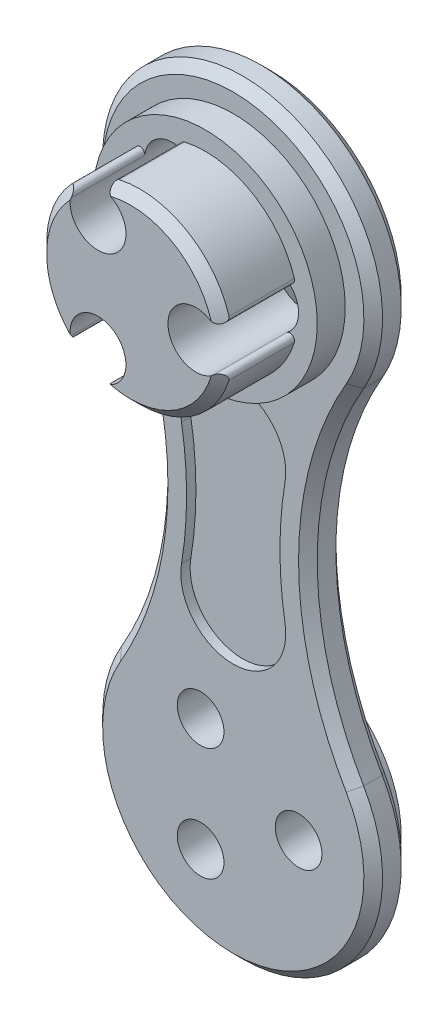
from build123d import *

# Parameters (mm, degrees)
EXTRUDE_1_DEPTH     = 1
SKETCH_2_R          = 6
EXTRUDE_2_DEPTH     = 1.5
SKETCH_3_R          = 7.5
EXTRUDE_3_DEPTH     = 1
SKETCH_4_R          = 5
EXTRUDE_4_DEPTH     = 4
CUT_EXTRUDE_2_DEPTH = 24.416996253
EXTRUDE_START       = -3.5
SKETCH_13_R         = 6
EXTRUDE_7_DEPTH     = 3.5
EXTRUDE_START_2     = -3
SKETCH_14_R         = 7.5
SKETCH_14_R_2       = 1.5
EXTRUDE_8_DEPTH     = 3
SKETCH_18_R         = 1.5
CUT_EXTRUDE_3_DEPTH = 23.279042024
SKETCH_19_R         = 1.5
SKETCH_19_R_2       = 1
EXTRUDE_9_DEPTH     = 3
M3X0_5_1_D          = 2.5
CUT_EXTRUDE_START   = -1
SKETCH_22_R         = 7.5
SKETCH_22_R_2       = 6
CUT_EXTRUDE_4_DEPTH = 1
CHAMFER_1_SIZE      = 1.7
CHAMFER_2_SIZE      = 0.5
CUT_EXTRUDE_5_DEPTH = 0.5
CUT_EXTRUDE_START_2 = -0.5
CUT_EXTRUDE_6_DEPTH = 0.5


with BuildPart() as part:
    # ｽｹｯﾁ1 → ﾎﾞｽ - 押し出し1 (new, symmetric)
    with BuildSketch(Plane.XY):
        with BuildLine():
            ThreePointArc((6.484806622, 9.222452779), (0, 20.490381), (-6.484806622, 9.222452779))
            ThreePointArc((-6.484806622, 9.222452779), (-4, 0), (-6.484806622, -9.222452779))
            ThreePointArc((-6.484806622, -9.222452779), (0, -20.490381), (6.484806622, -9.222452779))
            ThreePointArc((6.484806622, -9.222452779), (4, 0), (6.484806622, 9.222452779))
        make_face()
    extrude(amount=EXTRUDE_1_DEPTH, both=True)

    # ｽｹｯﾁ2 → ﾎﾞｽ - 押し出し2 (add)
    with BuildSketch(Plane.XY.offset(1)):
        with Locations(Location((0, 12.990381, 0), (0, 0, 180))):
            Circle(SKETCH_2_R)
    extrude(amount=EXTRUDE_2_DEPTH)

    # ｽｹｯﾁ3 → ﾎﾞｽ - 押し出し3 (add)
    with BuildSketch(Plane(origin=(0, 0, -1), x_dir=(-1, 0, 0), z_dir=(0, 0, -1))):
        with Locations((0, -12.990381)):
            Circle(SKETCH_3_R)
    extrude(amount=EXTRUDE_3_DEPTH)

    # ｽｹｯﾁ4 → ﾎﾞｽ - 押し出し4 (add)
    with BuildSketch(Plane.XY.offset(2.5)):
        with Locations((0, 12.990381)):
            Circle(SKETCH_4_R)
    extrude(amount=EXTRUDE_4_DEPTH)

    # ｽｹｯﾁ10 → ｶｯﾄ - 押し出し2 (cut, through all)
    with BuildSketch(Plane.XY.offset(6.5)):
        with BuildLine():
            ThreePointArc((-3.240977431, 16.185744986), (-1, 14.722431808), (-1.146777671, 17.394831782))
            ThreePointArc((-1.146777671, 17.394831782), (-1.295092138, 17.647661172), (-1.101305912, 17.867585659))
            ThreePointArc((-1.101305912, 17.867585659), (-2.5, 17.320508019), (-3.673130179, 16.382742226))
            ThreePointArc((-3.673130179, 16.382742226), (-3.385776872, 16.440603778), (-3.240977431, 16.185744986))
        make_face()
        with BuildLine():
            ThreePointArc((4.387755102, 14.199467795), (2, 12.990381), (4.387755102, 11.781294205))
            ThreePointArc((4.387755102, 11.781294205), (4.68086901, 11.783323606), (4.77443609, 11.505537567))
            ThreePointArc((4.77443609, 11.505537567), (5, 12.990381), (4.77443609, 14.475224433))
            ThreePointArc((4.77443609, 14.475224433), (4.68086901, 14.197438394), (4.387755102, 14.199467795))
        make_face()
        with BuildLine():
            ThreePointArc((-1.146777671, 8.585930218), (-1, 11.258330192), (-3.240977431, 9.795017014))
            ThreePointArc((-3.240977431, 9.795017014), (-3.385776872, 9.540158222), (-3.673130179, 9.598019774))
            ThreePointArc((-3.673130179, 9.598019774), (-2.5, 8.660253981), (-1.101305912, 8.113176341))
            ThreePointArc((-1.101305912, 8.113176341), (-1.295092138, 8.333100828), (-1.146777671, 8.585930218))
        make_face()
        with BuildLine():
            ThreePointArc((-3.673130179, -9.598019774), (-2.5, -8.660253981), (-1.101305912, -8.113176341))
            ThreePointArc((-1.101305912, -8.113176341), (-1.295092138, -8.333100828), (-1.146777671, -8.585930218))
            ThreePointArc((-1.146777671, -8.585930218), (-1, -11.258330192), (-3.240977431, -9.795017014))
            ThreePointArc((-3.240977431, -9.795017014), (-3.385776872, -9.540158222), (-3.673130179, -9.598019774))
        make_face()
        with BuildLine():
            ThreePointArc((4.77443609, -11.505537567), (5, -12.990381), (4.77443609, -14.475224433))
            ThreePointArc((4.77443609, -14.475224433), (4.68086901, -14.197438394), (4.387755102, -14.199467795))
            ThreePointArc((4.387755102, -14.199467795), (2, -12.990381), (4.387755102, -11.781294205))
            ThreePointArc((4.387755102, -11.781294205), (4.68086901, -11.783323606), (4.77443609, -11.505537567))
        make_face()
        with BuildLine():
            ThreePointArc((-1.101305912, -17.867585659), (-2.5, -17.320508019), (-3.673130179, -16.382742226))
            ThreePointArc((-3.673130179, -16.382742226), (-3.385776872, -16.440603778), (-3.240977431, -16.185744986))
            ThreePointArc((-3.240977431, -16.185744986), (-1, -14.722431808), (-1.146777671, -17.394831782))
            ThreePointArc((-1.146777671, -17.394831782), (-1.295092138, -17.647661172), (-1.101305912, -17.867585659))
        make_face()
    extrude(amount=-CUT_EXTRUDE_2_DEPTH, mode=Mode.SUBTRACT)

    # ｽｹｯﾁ13 → ﾎﾞｽ - 押し出し7 (add)
    with BuildSketch(Plane.XY.offset(2.5).offset(EXTRUDE_START)):
        with Locations(Location((0, 12.990381, 0), (0, 0, 180))):
            Circle(SKETCH_13_R)
    extrude(amount=EXTRUDE_7_DEPTH)

    # ｽｹｯﾁ14 → ﾎﾞｽ - 押し出し8 (add)
    with BuildSketch(Plane(origin=(0, 0, -2), x_dir=(-1, 0, 0), z_dir=(0, 0, -1)).offset(EXTRUDE_START_2)):
        with Locations((0, -12.990381)):
            Circle(SKETCH_14_R)
        with Locations((1.75, -9.959292087)):
            Circle(SKETCH_14_R_2, mode=Mode.SUBTRACT)
        with Locations((1.75, -16.021469913)):
            Circle(SKETCH_14_R_2, mode=Mode.SUBTRACT)
        with Locations((-3.5, -12.990381)):
            Circle(SKETCH_14_R_2, mode=Mode.SUBTRACT)
    extrude(amount=EXTRUDE_8_DEPTH)

    # ｽｹｯﾁ18 → ｶｯﾄ - 押し出し3 (cut, through all)
    with BuildSketch(Plane.XY.offset(2.5)):
        with Locations(Location((3.5, 12.990381, 0), (0, 0, 53.712542915))):
            Circle(SKETCH_18_R)
        with Locations(Location((-1.75, 16.021469913, 0), (0, 0, 66.287457085))):
            Circle(SKETCH_18_R)
        with Locations(Location((-1.75, 9.959292087, 0), (0, 0, 293.712542915))):
            Circle(SKETCH_18_R)
    extrude(amount=-CUT_EXTRUDE_3_DEPTH, mode=Mode.SUBTRACT)

    # ｽｹｯﾁ19 → ﾎﾞｽ - 押し出し9 (add)
    # profile 1 of 3: a face of its own
    with BuildSketch(Plane(origin=(0, 0, -2), x_dir=(-1, 0, 0), z_dir=(0, 0, -1)).offset(EXTRUDE_START_2)):
        with Locations((1.75, -9.959292087)):
            Circle(SKETCH_19_R)
        with Locations((1.75, -9.959292087)):
            Circle(SKETCH_19_R_2, mode=Mode.SUBTRACT)
    # profile 2 of 3: a face of its own
    with BuildSketch(Plane(origin=(0, 0, -2), x_dir=(-1, 0, 0), z_dir=(0, 0, -1)).offset(EXTRUDE_START_2)):
        with Locations((1.75, -16.021469913)):
            Circle(SKETCH_19_R)
        with Locations((1.75, -16.021469913)):
            Circle(SKETCH_19_R_2, mode=Mode.SUBTRACT)
    # profile 3 of 3: a face of its own
    with BuildSketch(Plane(origin=(0, 0, -2), x_dir=(-1, 0, 0), z_dir=(0, 0, -1)).offset(EXTRUDE_START_2)):
        with Locations((-3.5, -12.990381)):
            Circle(SKETCH_19_R)
        with Locations((-3.5, -12.990381)):
            Circle(SKETCH_19_R_2, mode=Mode.SUBTRACT)
    extrude(amount=EXTRUDE_9_DEPTH)

    # M3x0.5 ねじ穴1 (through all)
    with Locations(Plane.XY.offset(1)):
        with Locations((-1.75, -9.959292087), (-1.75, -16.021469913), (3.5, -12.990381)):
            Hole(M3X0_5_1_D / 2)

    # ｽｹｯﾁ22 → ｶｯﾄ - 押し出し4 (cut)
    with BuildSketch(Plane(origin=(0, 0, -2), x_dir=(-1, 0, 0), z_dir=(0, 0, -1)).offset(CUT_EXTRUDE_START)):
        with Locations((0, -12.990381)):
            Circle(SKETCH_22_R)
        with Locations((0, -12.990381)):
            Circle(SKETCH_22_R_2, mode=Mode.SUBTRACT)
    extrude(amount=CUT_EXTRUDE_4_DEPTH, mode=Mode.SUBTRACT)

    # 面取り1
    # the kernel refuses this chamfer: 1.7 mm, written as the material it takes off along each edge
    with BuildSketch(Plane(origin=(3.5, 12.990381, -1), x_dir=(0.5918367346923316, 0.8060578635983391, 0), z_dir=(0.8060578635983391, -0.5918367346923316, 0))) as chamfer_1_piece_1:
        Polygon((1.5, CHAMFER_1_SIZE), (1.5 + CHAMFER_1_SIZE, 0), (1.5, 0), align=None)
    revolve(axis=Axis((3.5, 12.990381, -1), (0, 0, 1)), mode=Mode.SUBTRACT)
    with BuildSketch(Plane(origin=(-1.75, 16.021469913, -1), x_dir=(0.40214821945020784, 0.9155745789355596, 0), z_dir=(0.9155745789355596, -0.40214821945020784, 0))) as chamfer_1_piece_2:
        Polygon((1.5, CHAMFER_1_SIZE), (1.5 + CHAMFER_1_SIZE, 0), (1.5, 0), align=None)
    revolve(axis=Axis((-1.75, 16.021469913, -1), (0, 0, 1)), mode=Mode.SUBTRACT)
    with BuildSketch(Plane(origin=(-1.75, 9.959292087, -1), x_dir=(0.40214821945020723, -0.9155745789355599, 0), z_dir=(-0.9155745789355599, -0.40214821945020723, 0))) as chamfer_1_piece_3:
        Polygon((1.5, CHAMFER_1_SIZE), (1.5 + CHAMFER_1_SIZE, 0), (1.5, 0), align=None)
    revolve(axis=Axis((-1.75, 9.959292087, -1), (0, 0, 1)), mode=Mode.SUBTRACT)

    # 面取り2
    # the kernel refuses this chamfer: 0.5 mm, written as the material it takes off along each edge
    with BuildSketch(Plane(origin=(-22.357142646, 0, -1), x_dir=(0.8646408828749567, 0.502390429507983, 0), z_dir=(-0.502390429507983, 0.8646408828749567, 0))) as chamfer_2_piece_1:
        Polygon((18.357142646, -CHAMFER_2_SIZE), (18.357142646 + CHAMFER_2_SIZE, 0), (18.357142646, 0), align=None)
    revolve(axis=Axis((-22.357142646, 0, -1), (0, 0, -1)), revolution_arc=60.316551922, mode=Mode.SUBTRACT)
    with BuildSketch(Plane(origin=(-22.357142646, 0, 1), x_dir=(0.8646408828749567, 0.502390429507983, 0), z_dir=(-0.502390429507983, 0.8646408828749567, 0))) as chamfer_2_piece_2:
        Polygon((18.357142646, CHAMFER_2_SIZE), (18.357142646 + CHAMFER_2_SIZE, 0), (18.357142646, 0), align=None)
    revolve(axis=Axis((-22.357142646, 0, 1), (0, 0, -1)), revolution_arc=60.316551922, mode=Mode.SUBTRACT)
    with BuildSketch(Plane(origin=(0, 12.990381, -1), x_dir=(0.8646408828749568, -0.5023904295079827, 0), z_dir=(-0.5023904295079827, -0.8646408828749568, 0))) as chamfer_2_piece_3:
        Polygon((7.5 - CHAMFER_2_SIZE, 0), (7.5, CHAMFER_2_SIZE), (7.5, 0), align=None)
    revolve(axis=Axis((0, 12.990381, -1), (0, 0, 1)), revolution_arc=240.316551922, mode=Mode.SUBTRACT)
    with BuildSketch(Plane(origin=(22.357142646, 0, -1), x_dir=(-0.8646408828749562, -0.5023904295079837, 0), z_dir=(0.5023904295079837, -0.8646408828749562, 0))) as chamfer_2_piece_4:
        Polygon((18.357142646 + CHAMFER_2_SIZE, 0), (18.357142646, -CHAMFER_2_SIZE), (18.357142646, 0), align=None)
    revolve(axis=Axis((22.357142646, 0, -1), (0, 0, -1)), revolution_arc=60.316551922, mode=Mode.SUBTRACT)
    with BuildSketch(Plane(origin=(0, -12.990381, -1), x_dir=(0.8646408828749563, 0.5023904295079835, 0), z_dir=(-0.5023904295079835, 0.8646408828749563, 0))) as chamfer_2_piece_5:
        Polygon((7.5 - CHAMFER_2_SIZE, 0), (7.5, -CHAMFER_2_SIZE), (7.5, 0), align=None)
    revolve(axis=Axis((0, -12.990381, -1), (0, 0, -1)), revolution_arc=240.316551922, mode=Mode.SUBTRACT)
    with BuildSketch(Plane(origin=(0, -12.990381, 1), x_dir=(0.8646408828749563, 0.5023904295079835, 0), z_dir=(-0.5023904295079835, 0.8646408828749563, 0))) as chamfer_2_piece_6:
        Polygon((7.5, CHAMFER_2_SIZE), (7.5 - CHAMFER_2_SIZE, 0), (7.5, 0), align=None)
    revolve(axis=Axis((0, -12.990381, 1), (0, 0, -1)), revolution_arc=240.316551922, mode=Mode.SUBTRACT)
    with BuildSketch(Plane(origin=(0, 12.990381, 1), x_dir=(0.8646408828749568, -0.5023904295079827, 0), z_dir=(-0.5023904295079827, -0.8646408828749568, 0))) as chamfer_2_piece_7:
        Polygon((7.5 - CHAMFER_2_SIZE, 0), (7.5, -CHAMFER_2_SIZE), (7.5, 0), align=None)
    revolve(axis=Axis((0, 12.990381, 1), (0, 0, 1)), revolution_arc=240.316551922, mode=Mode.SUBTRACT)
    with BuildSketch(Plane(origin=(22.357142646, 0, 1), x_dir=(-0.8646408828749562, -0.5023904295079837, 0), z_dir=(0.5023904295079837, -0.8646408828749562, 0))) as chamfer_2_piece_8:
        Polygon((18.357142646 + CHAMFER_2_SIZE, 0), (18.357142646, CHAMFER_2_SIZE), (18.357142646, 0), align=None)
    revolve(axis=Axis((22.357142646, 0, 1), (0, 0, -1)), revolution_arc=60.316551922, mode=Mode.SUBTRACT)
    with BuildSketch(Plane(origin=(0, 12.990381, 6.5), x_dir=(-0.46119688749448057, -0.8872978254032877, 0), z_dir=(-0.8872978254032877, 0.46119688749448057, 0))) as chamfer_2_piece_9:
        Polygon((5 - CHAMFER_2_SIZE, 0), (5, -CHAMFER_2_SIZE), (5, 0), align=None)
    revolve(axis=Axis((0, 12.990381, 6.5), (0, 0, 1)), revolution_arc=114.928734935, mode=Mode.SUBTRACT)
    with BuildSketch(Plane(origin=(0, 12.990381, 6.5), x_dir=(-0.5378240137746958, 0.8430571334181782, 0), z_dir=(0.8430571334181782, 0.5378240137746958, 0))) as chamfer_2_piece_10:
        Polygon((5 - CHAMFER_2_SIZE, 0), (5, -CHAMFER_2_SIZE), (5, 0), align=None)
    revolve(axis=Axis((0, 12.990381, 6.5), (0, 0, 1)), revolution_arc=114.928734935, mode=Mode.SUBTRACT)
    with BuildSketch(Plane(origin=(0, 12.990381, 6.5), x_dir=(0.9990209012691771, 0.044240691985109125, 0), z_dir=(0.044240691985109125, -0.9990209012691771, 0))) as chamfer_2_piece_11:
        Polygon((5 - CHAMFER_2_SIZE, 0), (5, -CHAMFER_2_SIZE), (5, 0), align=None)
    revolve(axis=Axis((0, 12.990381, 6.5), (0, 0, 1)), revolution_arc=114.928734935, mode=Mode.SUBTRACT)

    # ｽｹｯﾁ23 → ｶｯﾄ - 押し出し5 (cut)
    with BuildSketch(Plane.XY.offset(1)):
        with BuildLine():
            ThreePointArc((2.773570329, 3.284784525), (2.5, 0), (2.773570329, -3.284784525))
            ThreePointArc((2.773570329, -3.284784525), (0, -6.562315382), (-2.773570329, -3.284784525))
            ThreePointArc((-2.773570329, -3.284784525), (-2.5, 0), (-2.773570329, 3.284784525))
            ThreePointArc((-2.773570329, 3.284784525), (0, 6.562315382), (2.773570329, 3.284784525))
        make_face()
    extrude(amount=-CUT_EXTRUDE_5_DEPTH, mode=Mode.SUBTRACT)

    # ｽｹｯﾁ24 → ｶｯﾄ - 押し出し6 (cut)
    with BuildSketch(Plane(origin=(0, 0, -1), x_dir=(-1, 0, 0), z_dir=(0, 0, -1)).offset(CUT_EXTRUDE_START_2)):
        with BuildLine():
            ThreePointArc((-2.773570329, -3.284784525), (-2.5, 0), (-2.773570329, 3.284784525))
            ThreePointArc((-2.773570329, 3.284784525), (0, 6.562315382), (2.773570329, 3.284784525))
            ThreePointArc((2.773570329, 3.284784525), (2.5, 0), (2.773570329, -3.284784525))
            ThreePointArc((2.773570329, -3.284784525), (0, -6.562315382), (-2.773570329, -3.284784525))
        make_face()
    extrude(amount=CUT_EXTRUDE_6_DEPTH, mode=Mode.SUBTRACT)


solid = part.part
